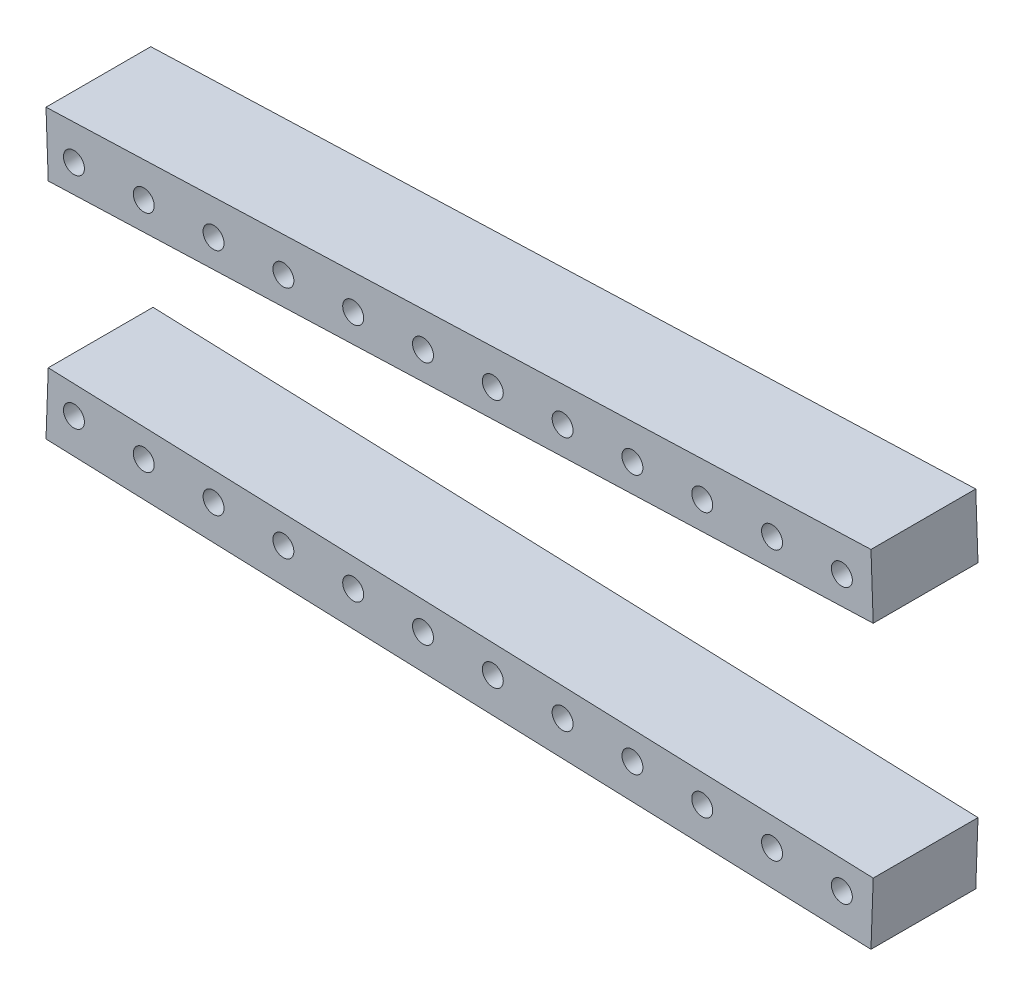
from build123d import *
from build123d.topology import SkipClean

# Parameters (mm, degrees)
EXTRUDE_3_DEPTH      = 5
SKETCH_4_R           = 1.5
SKETCH_4_R_2         = 4
CUT_EXTRUDE_3_DEPTH  = 5
SKETCH_5_R           = 11
CUT_EXTRUDE_4_DEPTH  = 2
SKETCH_6_R           = 1.5
CUT_EXTRUDE_6_DEPTH  = 169.745370307
SKETCH_7_R           = 1.5
CUT_EXTRUDE_7_DEPTH  = 10
SKETCH_8_R           = 11
CUT_EXTRUDE_8_DEPTH  = 10
SKETCH_9_R           = 1.5
CUT_EXTRUDE_9_DEPTH  = 10
SKETCH_10_R          = 5
CUT_EXTRUDE_10_DEPTH = 10
SKETCH_11_R          = 1.5
SKETCH_11_R_2        = 2
CUT_EXTRUDE_11_DEPTH = 10
SKETCH_12_W          = 41
SKETCH_12_H          = 22
CUT_EXTRUDE_12_DEPTH = 10
SKETCH_13_R          = 1.5
CUT_EXTRUDE_13_DEPTH = 10
EXTRUDE_4_DEPTH      = 5
SKETCH_15_R          = 1.5
EXTRUDE_6_DEPTH      = 5
SKETCH_16_R          = 1.5
CUT_EXTRUDE_14_DEPTH = 5
EXTRUDE_7_DEPTH      = 5
CUT_EXTRUDE_15_DEPTH = 5
CUT_EXTRUDE_19_DEPTH = 5
SKETCH_21_R          = 1.5
CUT_EXTRUDE_20_DEPTH = 5
EXTRUDE_8_DEPTH      = 10
SKETCH_23_R          = 1.5
CUT_EXTRUDE_21_DEPTH = 15


with BuildPart() as part:
    # 草图1 → 凸台-拉伸3 (new body)
    with BuildSketch(Plane.XY):
        with BuildLine():
            Line((140, 25), (0, 35))
            ThreePointArc((0, 35), (-35, 0), (0, -35))
            Line((0, -35), (140, -25))
            ThreePointArc((140, -25), (165, 0), (140, 25))
        make_face()
    extrude(amount=EXTRUDE_3_DEPTH)

    # 草图4 → 切除-拉伸3 (cut)
    with BuildSketch(Plane.XY.offset(5)):
        with Locations((-5, -5)):
            Circle(SKETCH_4_R)
        with Locations((5, -5)):
            Circle(SKETCH_4_R)
        with Locations((-5, 5)):
            Circle(SKETCH_4_R)
        with Locations((5, 5)):
            Circle(SKETCH_4_R)
        with Locations((135, -5)):
            Circle(SKETCH_4_R)
        with Locations((145, -5)):
            Circle(SKETCH_4_R)
        with Locations((135, 5)):
            Circle(SKETCH_4_R)
        with Locations((145, 5)):
            Circle(SKETCH_4_R)
        Circle(SKETCH_4_R_2)
        with Locations((140, 0)):
            Circle(SKETCH_4_R_2)
    extrude(amount=-CUT_EXTRUDE_3_DEPTH, mode=Mode.SUBTRACT)

    # 草图5 → 切除-拉伸4 (cut)
    with BuildSketch(Plane.XY.offset(5)):
        Circle(SKETCH_5_R)
        with Locations((140, 0)):
            Circle(SKETCH_5_R)
    extrude(amount=-CUT_EXTRUDE_4_DEPTH, mode=Mode.SUBTRACT)

    # 草图6 → 切除-拉伸6 (cut, through all)
    with BuildSketch(Plane.XY.offset(5)):
        with Locations((30, 0)):
            Circle(SKETCH_6_R)
        with Locations((25.980762114, 15)):
            Circle(SKETCH_6_R)
        with Locations((25.980762114, -15)):
            Circle(SKETCH_6_R)
        with Locations((15, 25.980762114)):
            Circle(SKETCH_6_R)
        with Locations((15, -25.980762114)):
            Circle(SKETCH_6_R)
        with Locations((0, 30)):
            Circle(SKETCH_6_R)
        with Locations((0, -30)):
            Circle(SKETCH_6_R)
        with Locations((-15, 25.980762114)):
            Circle(SKETCH_6_R)
        with Locations((-15, -25.980762114)):
            Circle(SKETCH_6_R)
        with Locations((-25.980762114, 15)):
            Circle(SKETCH_6_R)
        with Locations((-25.980762114, -15)):
            Circle(SKETCH_6_R)
        with Locations((-30, 0)):
            Circle(SKETCH_6_R)
        with Locations((160, 0)):
            Circle(SKETCH_6_R)
        with Locations((157.320508076, 10)):
            Circle(SKETCH_6_R)
        with Locations((157.320508076, -10)):
            Circle(SKETCH_6_R)
        with Locations((150, 17.320508076)):
            Circle(SKETCH_6_R)
        with Locations((150, -17.320508076)):
            Circle(SKETCH_6_R)
        with Locations((140, 20)):
            Circle(SKETCH_6_R)
        with Locations((140, -20)):
            Circle(SKETCH_6_R)
        with Locations((130, 17.320508076)):
            Circle(SKETCH_6_R)
        with Locations((130, -17.320508076)):
            Circle(SKETCH_6_R)
        with Locations((122.679491924, 10)):
            Circle(SKETCH_6_R)
        with Locations((122.679491924, -10)):
            Circle(SKETCH_6_R)
        with Locations((120, 0)):
            Circle(SKETCH_6_R)
    extrude(amount=-CUT_EXTRUDE_6_DEPTH, mode=Mode.SUBTRACT)

    # 草图7 → 切除-拉伸7 (cut)
    with SkipClean():  # the faces are left unmerged after this step: merging them gives an invalid solid
        with BuildSketch(Plane.XY.offset(5)):
            with BuildLine():
                ThreePointArc((138.21656051, 24.936305732), (139.107711737, 24.984071359), (140, 25))
                Line((140, 25), (0, 35))
                ThreePointArc((0, 35), (-35, 0), (0, -35))
                Line((0, -35), (140, -25))
                ThreePointArc((140, -25), (139.107711737, -24.984071359), (138.21656051, -24.936305732))
                Line((138.21656051, -24.936305732), (0, -20))
                ThreePointArc((0, -20), (-20, 0), (0, 20))
                Line((0, 20), (138.21656051, 24.936305732))
            make_face()
            with Locations((0, -30)):
                Circle(SKETCH_7_R, mode=Mode.SUBTRACT)
            with Locations((-15, -25.980762114)):
                Circle(SKETCH_7_R, mode=Mode.SUBTRACT)
            with Locations((15, -25.980762114)):
                Circle(SKETCH_7_R, mode=Mode.SUBTRACT)
            with Locations((-25.980762114, -15)):
                Circle(SKETCH_7_R, mode=Mode.SUBTRACT)
            with Locations((-30, 0)):
                Circle(SKETCH_7_R, mode=Mode.SUBTRACT)
            with Locations((-25.980762114, 15)):
                Circle(SKETCH_7_R, mode=Mode.SUBTRACT)
            with Locations((-15, 25.980762114)):
                Circle(SKETCH_7_R, mode=Mode.SUBTRACT)
            with Locations((0, 30)):
                Circle(SKETCH_7_R, mode=Mode.SUBTRACT)
            with Locations((15, 25.980762114)):
                Circle(SKETCH_7_R, mode=Mode.SUBTRACT)
        extrude(amount=-CUT_EXTRUDE_7_DEPTH, mode=Mode.SUBTRACT)

    # 草图8 → 切除-拉伸8 (cut)
    with SkipClean():  # the faces are left unmerged after this step: merging them gives an invalid solid
        with BuildSketch(Plane.XY.offset(5)):
            Circle(SKETCH_8_R)
        extrude(amount=-CUT_EXTRUDE_8_DEPTH, mode=Mode.SUBTRACT)

    # 草图9 → 切除-拉伸9 (cut)
    with SkipClean():  # the faces are left unmerged after this step: merging them gives an invalid solid
        with BuildSketch(Plane.XY.offset(5)):
            with Locations((15, 0)):
                Circle(SKETCH_9_R)
            with Locations((10.606601718, 10.606601718)):
                Circle(SKETCH_9_R)
            with Locations((10.606601718, -10.606601718)):
                Circle(SKETCH_9_R)
            with Locations((0, 15)):
                Circle(SKETCH_9_R)
            with Locations((0, -15)):
                Circle(SKETCH_9_R)
            with Locations((-10.606601718, 10.606601718)):
                Circle(SKETCH_9_R)
            with Locations((-10.606601718, -10.606601718)):
                Circle(SKETCH_9_R)
            with Locations((-15, 0)):
                Circle(SKETCH_9_R)
        extrude(amount=-CUT_EXTRUDE_9_DEPTH, mode=Mode.SUBTRACT)

    # 草图10 → 切除-拉伸10 (cut)
    with SkipClean():  # the faces are left unmerged after this step: merging them gives an invalid solid
        with BuildSketch(Plane.XY.offset(3)):
            with Locations((140, 0)):
                Circle(SKETCH_10_R)
        extrude(amount=-CUT_EXTRUDE_10_DEPTH, mode=Mode.SUBTRACT)

    # 草图11 → 切除-拉伸11 (cut)
    # profile 1 of 5: a face of its own
    with SkipClean():  # the faces are left unmerged after this step: merging them gives an invalid solid
        with BuildSketch(Plane.XY.offset(5)):
            with BuildLine():
                Line((124.179491924, -10), (150, -10))
                Line((150, -10), (150, 10))
                Line((150, 10), (124.179491924, 10))
                ThreePointArc((124.179491924, 10), (122.679491924, 8.5), (121.179491924, 10))
                Line((121.179491924, 10), (110, 10))
                Line((110, 10), (110, -10))
                Line((110, -10), (121.179491924, -10))
                ThreePointArc((121.179491924, -10), (122.679491924, -8.5), (124.179491924, -10))
            make_face()
            with Locations((120, 0)):
                Circle(SKETCH_11_R, mode=Mode.SUBTRACT)
        # profile 2 of 5: a face of its own
        with BuildSketch(Plane.XY.offset(5)):
            with Locations((105.5, 5)):
                Circle(SKETCH_11_R_2)
        # profile 3 of 5: a face of its own
        with BuildSketch(Plane.XY.offset(5)):
            with Locations((105.5, -5)):
                Circle(SKETCH_11_R_2)
        # profile 4 of 5: a face of its own
        with BuildSketch(Plane.XY.offset(5)):
            with Locations((154.5, -5)):
                Circle(SKETCH_11_R_2)
        # profile 5 of 5: a face of its own
        with BuildSketch(Plane.XY.offset(5)):
            with Locations((154.5, 5)):
                Circle(SKETCH_11_R_2)
        extrude(amount=-CUT_EXTRUDE_11_DEPTH, mode=Mode.SUBTRACT)

    # 草图12 → 切除-拉伸12 (cut)
    with SkipClean():  # the faces are left unmerged after this step: merging them gives an invalid solid
        with BuildSketch(Plane.XY.offset(5)):
            with Locations((130, 0)):
                Rectangle(SKETCH_12_W, SKETCH_12_H)
        extrude(amount=-CUT_EXTRUDE_12_DEPTH, mode=Mode.SUBTRACT)

    # 草图13 → 切除-拉伸13 (cut)
    with SkipClean():  # the faces are left unmerged after this step: merging them gives an invalid solid
        with BuildSketch(Plane.XY.offset(5)):
            with BuildLine():
                ThreePointArc((129.008722028, -18.446282468), (129.863637935, -21.138943397), (130.908449037, -18.514124575))
                ThreePointArc((130.908449037, -18.514124575), (129.94646687, -18.819552506), (129.008722028, -18.446282468))
            make_face()
            with Locations((119.923542522, -19.282983661)):
                Circle(SKETCH_13_R)
            with Locations((109.929913978, -18.926068356)):
                Circle(SKETCH_13_R)
            with Locations((99.936285435, -18.569153051)):
                Circle(SKETCH_13_R)
            with Locations((89.942656891, -18.212237746)):
                Circle(SKETCH_13_R)
            with Locations((79.949028348, -17.855322441)):
                Circle(SKETCH_13_R)
            with Locations((69.955399804, -17.498407136)):
                Circle(SKETCH_13_R)
            with Locations((59.961771261, -17.141491831)):
                Circle(SKETCH_13_R)
            with Locations((49.968142717, -16.784576526)):
                Circle(SKETCH_13_R)
            with Locations((39.974514174, -16.42766122)):
                Circle(SKETCH_13_R)
            with Locations((29.98088563, -16.070745915)):
                Circle(SKETCH_13_R)
            with Locations((19.987257087, -15.71383061)):
                Circle(SKETCH_13_R)
            with Locations((9.993628543, -15.356915305)):
                Circle(SKETCH_13_R)
        extrude(amount=-CUT_EXTRUDE_13_DEPTH, mode=Mode.SUBTRACT)

    # 草图14 → 凸台-拉伸4 (add)
    with SkipClean():  # the faces are left unmerged after this step: merging them gives an invalid solid
        with BuildSketch(Plane.XY.offset(5)):
            with BuildLine():
                ThreePointArc((130.908449037, -18.514124575), (131.344000289, -17.986588568), (131.5, -17.320508076))
                ThreePointArc((131.5, -17.320508076), (129.382309527, -15.953592395), (129.008722028, -18.446282468))
                ThreePointArc((129.008722028, -18.446282468), (129.970704195, -18.140854536), (130.908449037, -18.514124575))
            make_face()
        extrude(amount=-EXTRUDE_4_DEPTH)

    # 草图15 → 凸台-拉伸6 (add)
    with SkipClean():  # the faces are left unmerged after this step: merging them gives an invalid solid
        with BuildSketch(Plane.XY.offset(5)):
            with Locations((25.980762114, 15)):
                Circle(SKETCH_15_R)
            with Locations((30, 0)):
                Circle(SKETCH_15_R)
            with Locations((25.980762114, -15)):
                Circle(SKETCH_15_R)
        extrude(amount=-EXTRUDE_6_DEPTH)

    # 草图16 → 切除-拉伸14 (cut)
    with SkipClean():  # the faces are left unmerged after this step: merging them gives an invalid solid
        with BuildSketch(Plane.XY.offset(5)):
            with Locations((129.917171065, 19.639898967)):
                Circle(SKETCH_16_R)
            with Locations((119.923542522, 19.282983661)):
                Circle(SKETCH_16_R)
            with Locations((109.929913978, 18.926068356)):
                Circle(SKETCH_16_R)
            with Locations((99.936285435, 18.569153051)):
                Circle(SKETCH_16_R)
            with Locations((89.942656891, 18.212237746)):
                Circle(SKETCH_16_R)
            with Locations((79.949028348, 17.855322441)):
                Circle(SKETCH_16_R)
            with Locations((69.955399804, 17.498407136)):
                Circle(SKETCH_16_R)
            with Locations((59.961771261, 17.141491831)):
                Circle(SKETCH_16_R)
            with Locations((49.968142717, 16.784576526)):
                Circle(SKETCH_16_R)
            with Locations((39.974514174, 16.42766122)):
                Circle(SKETCH_16_R)
            with Locations((29.98088563, 16.070745915)):
                Circle(SKETCH_16_R)
            with Locations((19.987257087, 15.71383061)):
                Circle(SKETCH_16_R)
            with Locations((9.993628543, 15.356915305)):
                Circle(SKETCH_16_R)
        extrude(amount=-CUT_EXTRUDE_14_DEPTH, mode=Mode.SUBTRACT)

    # 草图17 → 凸台-拉伸7 (add)
    with SkipClean():  # the faces are left unmerged after this step: merging them gives an invalid solid
        with BuildSketch(Plane.XY.offset(5)):
            with BuildLine():
                ThreePointArc((129.008722028, 18.446282468), (129.382309527, 15.953592395), (131.5, 17.320508076))
                ThreePointArc((131.5, 17.320508076), (131.344000289, 17.986588568), (130.908449037, 18.514124575))
                ThreePointArc((130.908449037, 18.514124575), (129.970704195, 18.140854536), (129.008722028, 18.446282468))
            make_face()
        extrude(amount=-EXTRUDE_7_DEPTH)

    # 草图18 → 切除-拉伸15 (cut)
    with SkipClean():  # the faces are left unmerged after this step: merging them gives an invalid solid
        with BuildSketch(Plane.XY.offset(5)):
            with BuildLine():
                ThreePointArc((100, 0), (99.769776761, 6.781714021), (99.080167099, 13.532201878))
                Line((99.080167099, 13.532201878), (22.547372848, 10.798887797))
                ThreePointArc((22.547372848, 10.798887797), (24.379133713, 5.536952176), (25, 0))
                ThreePointArc((25, 0), (24.379133713, -5.536952176), (22.547372848, -10.798887797))
                Line((22.547372848, -10.798887797), (99.080167099, -13.532201878))
                ThreePointArc((99.080167099, -13.532201878), (99.769776761, -6.781714021), (100, 0))
            make_face()
        extrude(amount=-CUT_EXTRUDE_15_DEPTH, mode=Mode.SUBTRACT)

    # 草图19 → 切除-拉伸19 (cut)
    with SkipClean():  # the faces are left unmerged after this step: merging them gives an invalid solid
        with BuildSketch(Plane.XY.offset(5)):
            with BuildLine():
                Line((134.406294114, 15.794486823), (16.308878209, 11.576721969))
                Line((16.308878209, 11.576721969), (15.987654435, 20.570987658))
                Line((15.987654435, 20.570987658), (0, 20))
                ThreePointArc((0, 20), (-20, 0), (0, -20))
                Line((0, -20), (15.987654435, -20.570987658))
                Line((15.987654435, -20.570987658), (16.308878209, -11.576721969))
                Line((16.308878209, -11.576721969), (134.406294114, -15.794486823))
                ThreePointArc((134.406294114, -15.794486823), (156.755756012, 0), (134.406294114, 15.794486823))
            make_face()
        extrude(amount=-CUT_EXTRUDE_19_DEPTH, mode=Mode.SUBTRACT)

    # 草图21 → 切除-拉伸20 (cut)
    with SkipClean():  # the faces are left unmerged after this step: merging them gives an invalid solid
        with BuildSketch(Plane.XY.offset(5)):
            with BuildLine():
                ThreePointArc((134.406294114, 15.794486823), (146.604776394, 15.399100244), (155.298987649, 6.833471771))
                ThreePointArc((155.298987649, 6.833471771), (156.390745963, 5.651981367), (156.259259804, 4.048682523))
                ThreePointArc((156.259259804, 4.048682523), (156.755756012, 0), (156.259259804, -4.048682523))
                ThreePointArc((156.259259804, -4.048682523), (156.390745963, -5.651981367), (155.298987649, -6.833471771))
                ThreePointArc((155.298987649, -6.833471771), (146.604776394, -15.399100244), (134.406294114, -15.794486823))
                Line((134.406294114, -15.794486823), (134.08507034, -24.788752512))
                Line((134.08507034, -24.788752512), (138.21656051, -24.936305732))
                ThreePointArc((138.21656051, -24.936305732), (165, 0), (138.21656051, 24.936305732))
                Line((138.21656051, 24.936305732), (134.08507034, 24.788752512))
                Line((134.08507034, 24.788752512), (134.406294114, 15.794486823))
            make_face()
            with Locations((140, -20)):
                Circle(SKETCH_21_R, mode=Mode.SUBTRACT)
            with Locations((150, -17.320508076)):
                Circle(SKETCH_21_R, mode=Mode.SUBTRACT)
            with Locations((157.320508076, -10)):
                Circle(SKETCH_21_R, mode=Mode.SUBTRACT)
            with Locations((160, 0)):
                Circle(SKETCH_21_R, mode=Mode.SUBTRACT)
            with Locations((157.320508076, 10)):
                Circle(SKETCH_21_R, mode=Mode.SUBTRACT)
            with Locations((150, 17.320508076)):
                Circle(SKETCH_21_R, mode=Mode.SUBTRACT)
            with Locations((140, 20)):
                Circle(SKETCH_21_R, mode=Mode.SUBTRACT)
        extrude(amount=-CUT_EXTRUDE_20_DEPTH, mode=Mode.SUBTRACT)


with BuildPart() as cut_extrude_20_piece_1:
    # of the separate pieces the step leaves, piece 1, a body of its own (cut_extrude_20_pieces)
    add(part.part.solids().sort_by_distance((134.08507034, 24.788752512, 0))[0])



with BuildPart() as cut_extrude_20_piece_2:
    # of the separate pieces the step leaves, piece 2, a body of its own (cut_extrude_20_pieces)
    add(part.part.solids().sort_by_distance((134.08507034, -24.788752512, 0))[0])


with BuildPart() as cut_extrude_20_piece_1_1:
    with SkipClean():  # the faces are left unmerged after this step: merging them gives an invalid solid
        add(cut_extrude_20_piece_1.part)

        add(cut_extrude_20_piece_2.part)  # 凸台-拉伸8 merges 切除-拉伸20 piece 2
        # 草图22 → 凸台-拉伸8 (add)
        with BuildSketch(Plane(origin=(0, 0, 0), x_dir=(-1, 0, 0), z_dir=(0, 0, -1))):
            Polygon((-134.08507034, 24.788752512), (-134.406294114, 15.794486823), (-16.308878209, 11.576721969), (-15.987654435, 20.570987658), align=None)
            Polygon((-134.406294114, -15.794486823), (-134.08507034, -24.788752512), (-15.987654435, -20.570987658), (-16.308878209, -11.576721969), align=None)
        extrude(amount=EXTRUDE_8_DEPTH)

    # 草图23 → 切除-拉伸21 (cut)
    with SkipClean():  # the faces are left unmerged after this step: merging them gives an invalid solid
        with BuildSketch(Plane.XY.offset(5)):
            with Locations((19.987257087, 15.71383061)):
                Circle(SKETCH_23_R)
            with Locations((29.98088563, 16.070745915)):
                Circle(SKETCH_23_R)
            with Locations((39.974514174, 16.42766122)):
                Circle(SKETCH_23_R)
            with Locations((49.968142717, 16.784576526)):
                Circle(SKETCH_23_R)
            with Locations((59.961771261, 17.141491831)):
                Circle(SKETCH_23_R)
            with Locations((69.955399804, 17.498407136)):
                Circle(SKETCH_23_R)
            with Locations((79.949028348, 17.855322441)):
                Circle(SKETCH_23_R)
            with Locations((89.942656891, 18.212237746)):
                Circle(SKETCH_23_R)
            with Locations((99.936285435, 18.569153051)):
                Circle(SKETCH_23_R)
            with Locations((109.929913978, 18.926068356)):
                Circle(SKETCH_23_R)
            with Locations((119.923542522, 19.282983661)):
                Circle(SKETCH_23_R)
            with Locations((129.917171065, 19.639898967)):
                Circle(SKETCH_23_R)
            with Locations((129.917171065, -19.639898967)):
                Circle(SKETCH_23_R)
            with Locations((119.923542522, -19.282983661)):
                Circle(SKETCH_23_R)
            with Locations((109.929913978, -18.926068356)):
                Circle(SKETCH_23_R)
            with Locations((99.936285435, -18.569153051)):
                Circle(SKETCH_23_R)
            with Locations((89.942656891, -18.212237746)):
                Circle(SKETCH_23_R)
            with Locations((79.949028348, -17.855322441)):
                Circle(SKETCH_23_R)
            with Locations((69.955399804, -17.498407136)):
                Circle(SKETCH_23_R)
            with Locations((59.961771261, -17.141491831)):
                Circle(SKETCH_23_R)
            with Locations((49.968142717, -16.784576526)):
                Circle(SKETCH_23_R)
            with Locations((39.974514174, -16.42766122)):
                Circle(SKETCH_23_R)
            with Locations((29.98088563, -16.070745915)):
                Circle(SKETCH_23_R)
            with Locations((19.987257087, -15.71383061)):
                Circle(SKETCH_23_R)
        extrude(amount=-CUT_EXTRUDE_21_DEPTH, mode=Mode.SUBTRACT)


solid = cut_extrude_20_piece_1_1.part
